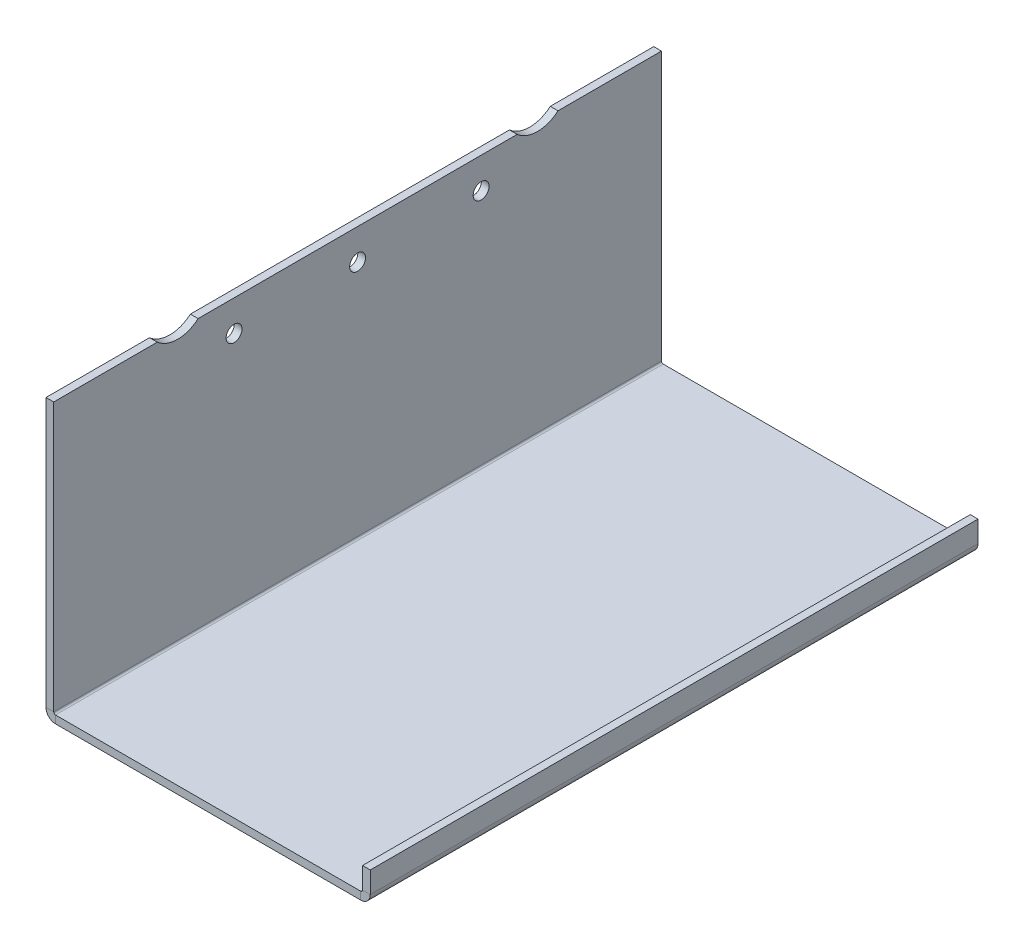
from build123d import *

# Parameters (mm, degrees)
SKETCH4_W                    = 133.35
SKETCH4_H                    = 249.936
BOSS_EXTRUDE2_DEPTH          = 1.5875
EDGE_FLANGE1_STRIP_W         = 14.1732
EDGE_FLANGE1_STRIP_H         = 3.175
EDGE_FLANGE1_STRIP_CUT_DEPTH = 249.936
EDGE_FLANGE1_DEPTH           = 249.936
EDGE_FLANGE2_STRIP_W         = 14.1732
EDGE_FLANGE2_STRIP_H         = 3.175
EDGE_FLANGE2_STRIP_CUT_DEPTH = 249.936
EDGE_FLANGE2_DEPTH           = 249.936
SKETCH18_R                   = 3.2639
CUT_EXTRUDE1_DEPTH           = 213.759580995
SKETCH20_R                   = 12.7
CUT_EXTRUDE2_DEPTH           = 213.759580995


# Sheet-metal steps are written as plain solids
with BuildPart() as part:
    # Sketch4 → Boss-Extrude2 (new, symmetric)
    with BuildSketch(Plane(origin=(0, 0, 0), x_dir=(1, 0, 0), z_dir=(0, 1, 0))):
        Rectangle(SKETCH4_W, SKETCH4_H)
    extrude(amount=BOSS_EXTRUDE2_DEPTH, both=True)

    # Edge-Flange1 strip (across the edge) → Edge-Flange1 strip cut (cut)
    with BuildSketch(Plane(origin=(-66.675, 1.5875, -124.968), x_dir=(1, 0, 0), z_dir=(0, 0, 1))):
        with Locations((-3.175, -1.5875)):
            Rectangle(EDGE_FLANGE1_STRIP_W, EDGE_FLANGE1_STRIP_H)
    extrude(amount=EDGE_FLANGE1_STRIP_CUT_DEPTH, mode=Mode.SUBTRACT)

    # Edge-Flange1 section (across the edge) → Edge-Flange1 (add)
    with BuildSketch(Plane(origin=(-66.675, 1.5875, -124.968), x_dir=(1, 0, 0), z_dir=(0, 0, 1))):
        with BuildLine():
            Line((0, 0.7366), (0, 111.125))
            Line((0, 111.125), (3.175, 111.125))
            Line((3.175, 111.125), (3.175, 0.7366))
            ThreePointArc((3.175, 0.7366), (3.390745145, 0.215745145), (3.9116, 0))
            Line((3.9116, 0), (3.9116, -3.175))
            ThreePointArc((3.9116, -3.175), (1.145681115, -2.029318885), (0, 0.7366))
        make_face()
    extrude(amount=EDGE_FLANGE1_DEPTH)

    # Edge-Flange2 strip (across the edge) → Edge-Flange2 strip cut (cut)
    with BuildSketch(Plane(origin=(66.675, 1.5875, 124.968), x_dir=(-1, 0, 0), z_dir=(0, 0, -1))):
        with Locations((-3.175, -1.5875)):
            Rectangle(EDGE_FLANGE2_STRIP_W, EDGE_FLANGE2_STRIP_H)
    extrude(amount=EDGE_FLANGE2_STRIP_CUT_DEPTH, mode=Mode.SUBTRACT)

    # Edge-Flange2 section (across the edge) → Edge-Flange2 (add)
    with BuildSketch(Plane(origin=(66.675, 1.5875, 124.968), x_dir=(-1, 0, 0), z_dir=(0, 0, -1))):
        with BuildLine():
            Line((0, 0.7366), (0, 9.525))
            Line((0, 9.525), (3.175, 9.525))
            Line((3.175, 9.525), (3.175, 0.7366))
            ThreePointArc((3.175, 0.7366), (3.390745145, 0.215745145), (3.9116, 0))
            Line((3.9116, 0), (3.9116, -3.175))
            ThreePointArc((3.9116, -3.175), (1.145681115, -2.029318885), (0, 0.7366))
        make_face()
    extrude(amount=EDGE_FLANGE2_DEPTH)

    # Sketch18 → Cut-Extrude1 (cut, through all)
    with BuildSketch(Plane(origin=(-63.5, 0, 0), x_dir=(0, 0, -1), z_dir=(1, 0, 0))):
        with Locations(Location((-50.8, 100.0125, 0), (0, 0, 90))):
            Circle(SKETCH18_R)
        with Locations(Location((50.8, 100.0125, 0), (0, 0, 270))):
            Circle(SKETCH18_R)
        with Locations(Location((0, 100.0125, 0), (0, 0, 90))):
            Circle(SKETCH18_R)
    extrude(amount=-CUT_EXTRUDE1_DEPTH, mode=Mode.SUBTRACT)

    # Sketch20 → Cut-Extrude2 (cut, through all)
    with BuildSketch(Plane(origin=(-63.5, 0, 0), x_dir=(0, 0, -1), z_dir=(1, 0, 0))):
        with Locations((-74, 122.2375)):
            Circle(SKETCH20_R)
        with Locations((74, 122.2375)):
            Circle(SKETCH20_R)
    extrude(amount=-CUT_EXTRUDE2_DEPTH, mode=Mode.SUBTRACT)


solid = part.part
